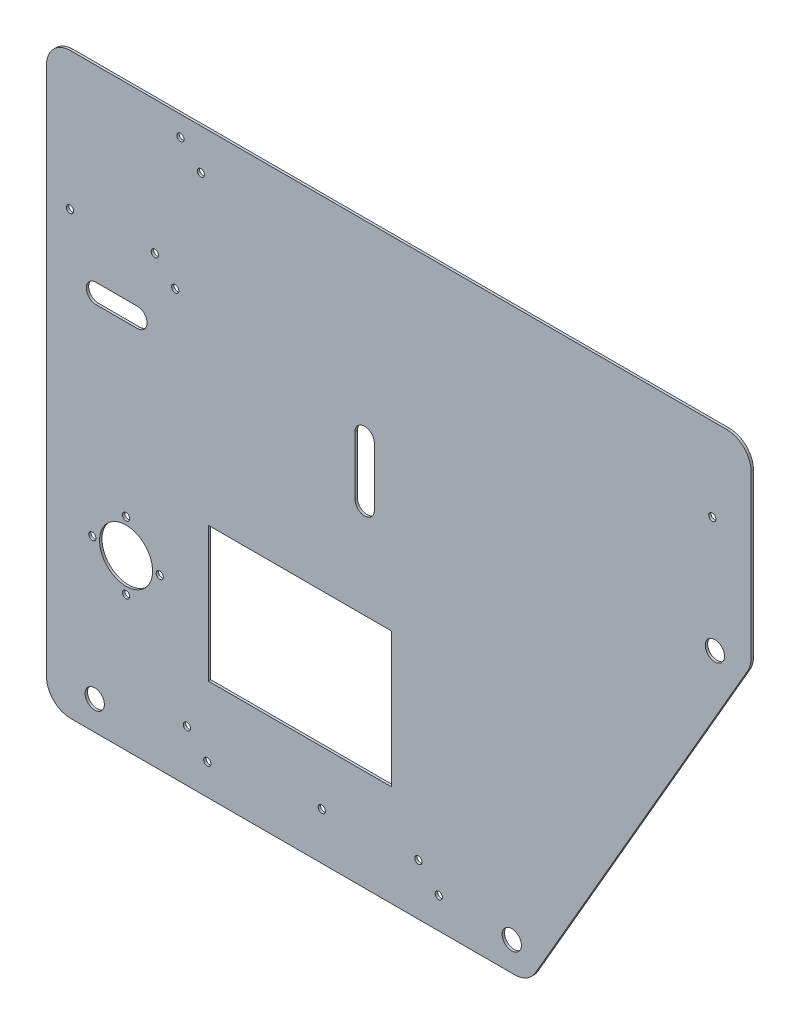
from build123d import *

# Parameters (mm, degrees)
BOSS_EXTRUDE1_DEPTH = 1
SKETCH2_R           = 4
SKETCH2_R_2         = 11
SKETCH2_R_3         = 1.5
SKETCH2_W           = 76
SKETCH2_H           = 56
CUT_EXTRUDE1_DEPTH  = 3
SKETCH3_W           = 292.37604307
SKETCH3_H           = 50
BOSS_EXTRUDE2_DEPTH = 1
FILLET1_R           = 10
SKETCH4_R           = 1.5
CUT_EXTRUDE2_DEPTH  = 11


with BuildPart() as part:
    # Sketch1 → Boss-Extrude1 (new body)
    with BuildSketch(Plane.XY):
        Polygon((-100, 110), (-100, -80), (100, -80), (192.37604307, 80), (192.37604307, 110), align=None)
    extrude(amount=BOSS_EXTRUDE1_DEPTH)

    # Sketch2 → Cut-Extrude1 (cut)
    with BuildSketch(Plane.XY.offset(1)):
        with Locations((93.07179677, -68)):
            Circle(SKETCH2_R)
        with Locations((177.364936071, 78)):
            Circle(SKETCH2_R)
        with Locations((-67, -10)):
            Circle(SKETCH2_R_2)
        with Locations((-80, -68)):
            Circle(SKETCH2_R)
        with Locations((-53, -10)):
            Circle(SKETCH2_R_3)
        with Locations((-67, 4)):
            Circle(SKETCH2_R_3)
        with Locations((-81, -10)):
            Circle(SKETCH2_R_3)
        with Locations((-67, -24)):
            Circle(SKETCH2_R_3)
        with Locations((62.79605759, -67.242640687)):
            Circle(SKETCH2_R_3)
        with Locations((54.310776216, -58.757359313)):
            Circle(SKETCH2_R_3)
        with Locations((-33.274226936, -67.242640687)):
            Circle(SKETCH2_R_3)
        with Locations((-41.75950831, -58.757359313)):
            Circle(SKETCH2_R_3)
        with Locations((14.225855729, -60.5)):
            Circle(SKETCH2_R_3)
        with Locations((-46.588971723, 96.138798421)):
            Circle(SKETCH2_R_3)
        with Locations((-55.074253097, 104.624079796)):
            Circle(SKETCH2_R_3)
        with Locations((-90.295627115, 102.881439108)):
            Circle(SKETCH2_R_3)
        with Locations((176.305585362, 125.488938255)):
            Circle(SKETCH2_R_3)
        with BuildLine():
            Line((-79.516586773, 82), (-62.300333374, 82))
            ThreePointArc((-62.300333374, 82), (-58.300333374, 78), (-62.300333374, 74))
            Line((-62.300333374, 74), (-79.516586773, 74))
            ThreePointArc((-79.516586773, 74), (-83.516586773, 78), (-79.516586773, 82))
        make_face()
        with Locations((5.141640745, -10)):
            Rectangle(SKETCH2_W, SKETCH2_H)
        with BuildLine():
            Line((36.026164778, 82), (36.026164778, 57.777585682))
            ThreePointArc((36.026164778, 57.777585682), (32.026164778, 53.777585682), (28.026164778, 57.777585682))
            Line((28.026164778, 57.777585682), (28.026164778, 82))
            ThreePointArc((28.026164778, 82), (32.026164778, 86), (36.026164778, 82))
        make_face()
    extrude(amount=-CUT_EXTRUDE1_DEPTH, mode=Mode.SUBTRACT)

    # Sketch3 → Boss-Extrude2 (add)
    with BuildSketch(Plane.XY.offset(1)):
        with Locations((46.188021535, 135)):
            Rectangle(SKETCH3_W, SKETCH3_H)
    extrude(amount=-BOSS_EXTRUDE2_DEPTH)

    # Fillet1
    fillet1_edges = [part.edges().sort_by_distance(p)[0] for p in [
        (100, -80, 0.5),
        (-100, -80, 0.5),
        (-100, 160, 0.5),
        (192.37604307, 160, 0.5),
        (192.37604307, 80, 0.5),
    ]]
    fillet(fillet1_edges, radius=FILLET1_R)

    # Sketch4 → Cut-Extrude2 (cut)
    with BuildSketch(Plane.XY.offset(1)):
        with Locations((-44.442274409, 151.624079796)):
            Circle(SKETCH4_R)
        with Locations((-35.956993035, 143.138798421)):
            Circle(SKETCH4_R)
        with Locations((176.305585362, 125.488938255)):
            Circle(SKETCH4_R)
    extrude(amount=-CUT_EXTRUDE2_DEPTH, mode=Mode.SUBTRACT)


solid = part.part
